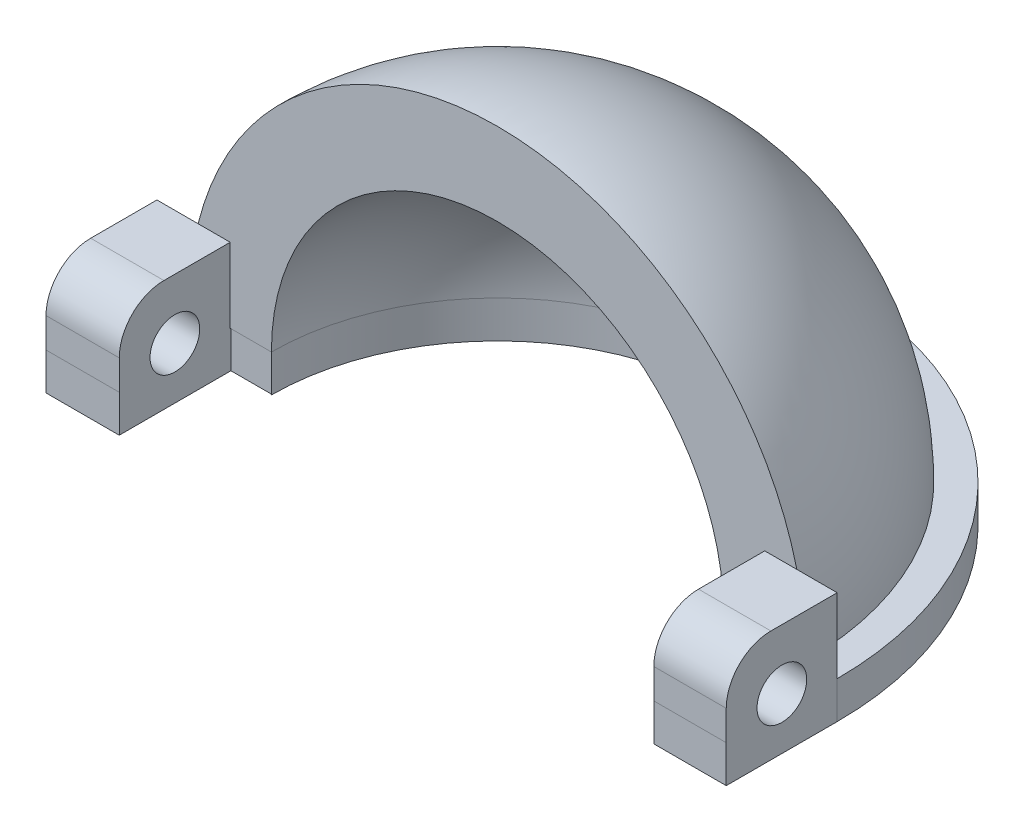
from build123d import *

# Parameters (mm, degrees)
BOSS_EXTRUDE2_DEPTH = 2.54
REVOLVE1_ANGLE      = 90
SKETCH8_W           = 4.942667085
SKETCH8_H           = 7.570002741
BOSS_EXTRUDE6_DEPTH = 5.08
SKETCH9_W           = 4.999318902
SKETCH9_H           = 7.570002741
BOSS_EXTRUDE7_DEPTH = 5.08
FILLET8_R           = 3.048
FILLET9_R           = 3.048
SKETCH33_R          = 1.695511812
CUT_EXTRUDE1_DEPTH  = 50.546
SKETCH34_W          = 2.811975891
SKETCH34_H          = 2.54
CUT_EXTRUDE2_DEPTH  = 7.62
SKETCH35_W          = 2.832955299
SKETCH35_H          = 2.54
CUT_EXTRUDE3_DEPTH  = 7.62


with BuildPart() as part:
    # Sketch1 → Boss-Extrude2 (new body)
    with BuildSketch(Plane(origin=(0, 0, 0), x_dir=(1, 0, 0), z_dir=(0, 1, 0))):
        with BuildLine():
            Line((0, 0), (0, -7.570002741))
            Line((0, -7.570002741), (7.811294793, -7.570002741))
            Line((7.811294793, -7.570002741), (7.811294793, 0))
            ThreePointArc((7.811294793, 0), (23.238051165, 15.426756373), (38.664807538, 0))
            Line((38.664807538, 0), (38.664807538, -7.570002741))
            Line((38.664807538, -7.570002741), (46.419938239, -7.570002741))
            Line((46.419938239, -7.570002741), (46.419938239, 0))
            ThreePointArc((46.419938239, 0), (23.20996912, 23.20996912), (0, 0))
        make_face()
    extrude(amount=BOSS_EXTRUDE2_DEPTH)

    # Sketch2 → Revolve1 (revolve)
    with BuildSketch(Plane(origin=(0, 2.54, 0), x_dir=(1, 0, 0), z_dir=(0, 1, 0))):
        with BuildLine():
            Line((2.187343011, 0), (7.811294793, 0))
            ThreePointArc((7.811294793, 0), (23.238051165, 15.426756373), (38.664807538, 0))
            Line((38.664807538, 0), (44.28973477, 0))
            ThreePointArc((44.28973477, 0), (23.238538891, 21.051195879), (2.187343011, 0))
        make_face()
    revolve(axis=Axis((38.664807538, 2.54, 0), (1, 0, 0)), revolution_arc=REVOLVE1_ANGLE)

    # Sketch8 → Boss-Extrude6 (add)
    with BuildSketch(Plane(origin=(0, 2.54, 0), x_dir=(1, 0, 0), z_dir=(0, 1, 0))):
        with Locations((43.948604696, -3.785001371)):
            Rectangle(SKETCH8_W, SKETCH8_H)
    extrude(amount=BOSS_EXTRUDE6_DEPTH)

    # Sketch9 → Boss-Extrude7 (add)
    with BuildSketch(Plane(origin=(0, 2.54, 0), x_dir=(1, 0, 0), z_dir=(0, 1, 0))):
        with Locations((2.499659451, -3.785001371)):
            Rectangle(SKETCH9_W, SKETCH9_H)
    extrude(amount=BOSS_EXTRUDE7_DEPTH)

    # Fillet8
    fillet8_edges = [part.edges().sort_by_distance(p)[0] for p in [
        (43.948604697, 7.62, 7.570002741),
    ]]
    fillet(fillet8_edges, radius=FILLET8_R)

    # Fillet9
    fillet9_edges = [part.edges().sort_by_distance(p)[0] for p in [
        (2.499659451, 7.62, 7.570002741),
    ]]
    fillet(fillet9_edges, radius=FILLET9_R)

    # Sketch33 → Cut-Extrude1 (cut)
    with BuildSketch(Plane(origin=(46.419938239, 0, 0), x_dir=(0, 0, -1), z_dir=(1, 0, 0))):
        with Locations((-3.774591428, 3.536542461)):
            Circle(SKETCH33_R)
    extrude(amount=-CUT_EXTRUDE1_DEPTH, mode=Mode.SUBTRACT)

    # Sketch34 → Cut-Extrude2 (cut)
    with BuildSketch(Plane.XY.offset(7.570002741)):
        with Locations((6.405306848, 1.27)):
            Rectangle(SKETCH34_W, SKETCH34_H)
    extrude(amount=-CUT_EXTRUDE2_DEPTH, mode=Mode.SUBTRACT)

    # Sketch35 → Cut-Extrude3 (cut)
    with BuildSketch(Plane.XY.offset(7.570002741)):
        with Locations((40.081285188, 1.27)):
            Rectangle(SKETCH35_W, SKETCH35_H)
    extrude(amount=-CUT_EXTRUDE3_DEPTH, mode=Mode.SUBTRACT)


solid = part.part
